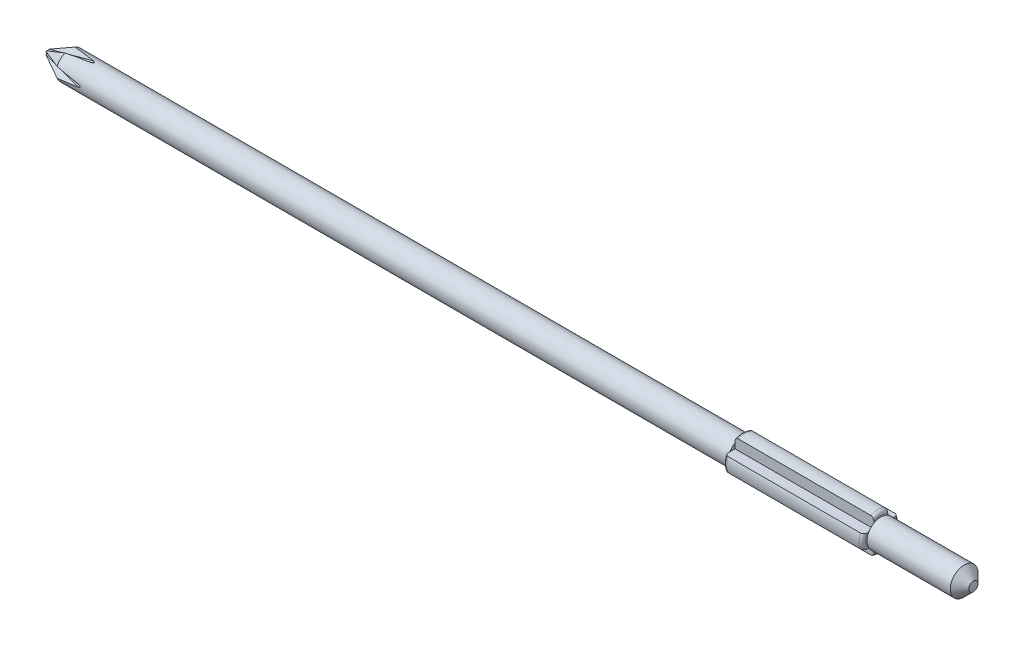
from build123d import *

# Parameters (mm, degrees)
CUT_EXTRUDE1_START = -0.75
SKETCH2_W          = 15
SKETCH2_H          = 10.027588319
CUT_EXTRUDE1_DEPTH = 10
CIRPATTERN1_COUNT  = 4
CHAMFER1_SIZE      = 1
CIRPATTERN2_COUNT  = 4


with BuildPart() as part:
    # Sketch1 → Revolve1 (revolve)
    with BuildSketch(Plane.XY, mode=Mode.PRIVATE) as revolve1_sk:
        with BuildLine():
            Line((0, 0.25), (2.4, 1.5))
            Line((2.4, 1.5), (75, 1.5))
            Line((75, 1.5), (75, 1.65))
            ThreePointArc((75, 1.65), (75.102512627, 1.897487373), (75.35, 2))
            Line((75.35, 2), (89.65, 2))
            ThreePointArc((89.65, 2), (89.897487373, 1.897487373), (90, 1.65))
            Line((90, 1.65), (90, 1.5))
            Line((90, 1.5), (100, 1.5))
            Line((100, 1.5), (100, 0))
            Line((100, 0), (0, 0))
            Line((0, 0), (0, 0.25))
        make_face()
    revolve(revolve1_sk.sketch.rotate(Axis((0, 0, 0), (1, 0, 0)), 90), axis=Axis((0, 0, 0), (1, 0, 0)))

    # Sketch2 → Cut-Extrude1 (cut)
    with BuildSketch(Plane(origin=(0, 0, 0), x_dir=(1, 0, 0), z_dir=(0, 1, 0)).offset(CUT_EXTRUDE1_START)):
        with Locations((82.5, 5.76379416)):
            Rectangle(SKETCH2_W, SKETCH2_H)
    cut_extrude1 = extrude(amount=-CUT_EXTRUDE1_DEPTH, mode=Mode.SUBTRACT)

    # CirPattern1: Cut-Extrude1 ×4 about axis
    cirpattern1_axis = Axis((0, 0, 0), (1, 0, 0))
    for i in range(1, CIRPATTERN1_COUNT):
        add(cut_extrude1.rotate(cirpattern1_axis, i * 360 / CIRPATTERN1_COUNT), mode=Mode.SUBTRACT)

    # Chamfer1
    chamfer1_edges = [part.edges().sort_by_distance(p)[0] for p in [
        (100, 0, -1.5),
    ]]
    chamfer(chamfer1_edges, length=CHAMFER1_SIZE)

    # Boundary-Cut1: read off the stored shape, not the designer's step
    # Boundary-Cut1: loft between two sections, ruled curve by curve
    boundary_cut1_from = [
        Edge.make_bspline([(5, 2.55, -0.727350269), (5, 1.55, -0.15)], [0, 0, 1, 1], 1),
        Edge.make_bspline([(5, 1.55, -0.15), (5, 1.533912472, -0.128549963), (5, 1.508697788, -0.080446135), (5, 1.495645717, 1.2689e-05), (5, 1.508698916, 0.080439687), (5, 1.533912472, 0.128549963), (5, 1.55, 0.15)], [0, 0, 0, 0, 0.25, 0.5, 0.75, 1, 1, 1, 1], 3),
        Edge.make_bspline([(5, 1.55, 0.15), (5, 2.55, 0.727350269)], [0, 0, 1, 1], 1),
        Edge.make_line((5, 2.55, 0.727350269), (5, 2.55, -0.727350269)),
    ]
    boundary_cut1_to = [
        Edge.make_bspline([(0, 1.5, -1.240829521), (0, 0.2, -0.15)], [0, 0, 1, 1], 1),
        Edge.make_bspline([(0, 0.2, -0.15), (0, 0.183912472, -0.128549963), (0, 0.158697788, -0.080446135), (0, 0.145645717, 1.2689e-05), (0, 0.158698916, 0.080439687), (0, 0.183912472, 0.128549963), (0, 0.2, 0.15)], [0, 0, 0, 0, 0.25, 0.5, 0.75, 1, 1, 1, 1], 3),
        Edge.make_bspline([(0, 0.2, 0.15), (0, 1.5, 1.240829521)], [0, 0, 1, 1], 1),
        Edge.make_line((0, 1.5, 1.240829521), (0, 1.5, -1.240829521)),
    ]
    boundary_cut1 = Solid(Shell([*[Face.make_surface_from_curves(boundary_cut1_from[k], boundary_cut1_to[k]) for k in range(4)], Face(Wire(boundary_cut1_from)), Face(Wire(boundary_cut1_to))]))
    add(boundary_cut1, mode=Mode.SUBTRACT)

    # CirPattern2: Boundary-Cut1 ×4 about axis
    cirpattern2_axis = Axis((0, 0, 0), (-1, 0, 0))
    for i in range(1, CIRPATTERN2_COUNT):
        add(boundary_cut1.rotate(cirpattern2_axis, i * 360 / CIRPATTERN2_COUNT), mode=Mode.SUBTRACT)


solid = part.part
